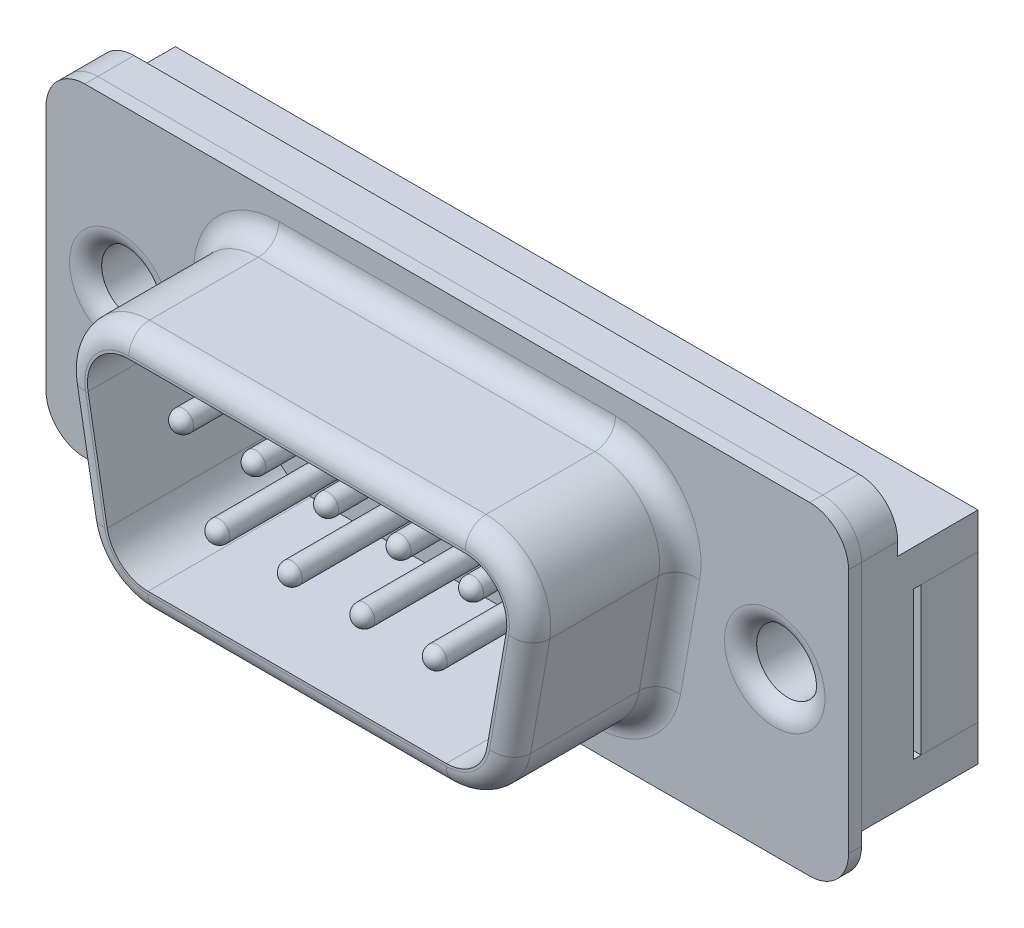
from build123d import *

# Parameters (mm, degrees)
CROQUIS1_W            = 31
CROQUIS1_H            = 12.5
EXTRUIR1_DEPTH        = 0.5
REDONDEO1_R           = 1.5
EXTRUIR2_DEPTH        = 5.8
CORTAR_EXTRUIR1_DEPTH = 9.8
REDONDEO2_R           = 0.8
REDONDEO3_R           = 0.8
CROQUIS4_R            = 1.2
CORTAR_EXTRUIR2_DEPTH = 9.8
REDONDEO4_R           = 0.8
EXTRUIR3_DEPTH        = 4.5
CROQUIS6_W            = 4.094383516
CROQUIS6_H            = 3.116234629
CORTAR_EXTRUIR3_DEPTH = 36.5
CROQUIS7_W            = 5.7
CROQUIS7_H            = 5.7
CORTAR_EXTRUIR4_DEPTH = 2.5
CROQUIS8_R            = 1.2
CORTAR_EXTRUIR5_DEPTH = 2.5
CROQUIS11_W           = 5.7
CROQUIS11_H           = 5.7
CROQUIS11_R           = 1.2
EXTRUIR5_DEPTH        = 2.2
EXTRUIR5_2_DEPTH      = 2.2
CROQUIS12_R           = 0.4
EXTRUIR6_DEPTH        = 5.5
EXTRUIR6_2_DEPTH      = 5.5
EXTRUIR6_3_DEPTH      = 5.5
EXTRUIR6_4_DEPTH      = 5.5
EXTRUIR6_5_DEPTH      = 5.5
EXTRUIR6_6_DEPTH      = 5.5
EXTRUIR6_7_DEPTH      = 5.5
EXTRUIR6_8_DEPTH      = 5.5
EXTRUIR6_9_DEPTH      = 5.5
REDONDEO5_R           = 0.4
REDONDEO6_R           = 0.4
REDONDEO7_R           = 0.4
REDONDEO8_R           = 0.4
REDONDEO9_R           = 0.4
REDONDEO10_R          = 0.4
REDONDEO11_R          = 0.4
REDONDEO12_R          = 0.4
REDONDEO13_R          = 0.4


with BuildPart() as part:
    # Croquis1 → Extruir1 (new body)
    with BuildSketch(Plane.XY):
        Rectangle(CROQUIS1_W, CROQUIS1_H)
    extrude(amount=EXTRUIR1_DEPTH)

    # Redondeo1
    redondeo1_edges = [part.edges().sort_by_distance(p)[0] for p in [
        (-15.5, 6.25, 0.25),
        (15.5, 6.25, 0.25),
        (15.5, -6.25, 0.25),
        (-15.5, -6.25, 0.25),
    ]]
    fillet(redondeo1_edges, radius=REDONDEO1_R)

    # Croquis2 → Extruir2 (add)
    with BuildSketch(Plane.XY.offset(0.5)):
        with BuildLine():
            Line((-6.5, 4.6), (6.5, 4.6))
            ThreePointArc((6.5, 4.6), (8.415111108, 3.706969024), (8.962019383, 1.665879556))
            Line((8.962019383, 1.665879556), (8.221446064, -2.534120444))
            ThreePointArc((8.221446064, -2.534120444), (7.366395705, -4.015111108), (5.759426681, -4.6))
            Line((5.759426681, -4.6), (-5.759426681, -4.6))
            ThreePointArc((-5.759426681, -4.6), (-7.366395705, -4.015111108), (-8.221446064, -2.534120444))
            Line((-8.221446064, -2.534120444), (-8.962019383, 1.665879556))
            ThreePointArc((-8.962019383, 1.665879556), (-8.415111108, 3.706969024), (-6.5, 4.6))
        make_face()
    extrude(amount=EXTRUIR2_DEPTH)

    # Croquis3 → Cortar-Extruir1 (cut)
    with BuildSketch(Plane.XY.offset(6.3)):
        with BuildLine():
            Line((-5.759426681, -3.7), (5.759426681, -3.7))
            ThreePointArc((5.759426681, -3.7), (6.787886857, -3.325671109), (7.335119086, -2.377837084))
            Line((7.335119086, -2.377837084), (8.075692405, 1.822162916))
            ThreePointArc((8.075692405, 1.822162916), (7.725671109, 3.128460175), (6.5, 3.7))
            Line((6.5, 3.7), (-6.5, 3.7))
            ThreePointArc((-6.5, 3.7), (-7.725671109, 3.128460175), (-8.075692405, 1.822162916))
            Line((-8.075692405, 1.822162916), (-7.335119086, -2.377837084))
            ThreePointArc((-7.335119086, -2.377837084), (-6.787886857, -3.325671109), (-5.759426681, -3.7))
        make_face()
    extrude(amount=-CORTAR_EXTRUIR1_DEPTH, mode=Mode.SUBTRACT)

    # Redondeo2
    redondeo2_edges = [part.edges().sort_by_distance(p)[0] for p in [
        (-7.366395705, -4.015111108, 6.3),
        (0, -4.6, 6.3),
        (7.366395705, -4.015111108, 6.3),
        (8.591732723, -0.434120444, 6.3),
        (8.415111108, 3.706969024, 6.3),
        (0, 4.6, 6.3),
        (-8.415111108, 3.706969024, 6.3),
        (-8.591732723, -0.434120444, 6.3),
    ]]
    fillet(redondeo2_edges, radius=REDONDEO2_R)

    # Redondeo3
    redondeo3_edges = [part.edges().sort_by_distance(p)[0] for p in [
        (-7.366395705, -4.015111108, 0.5),
        (0, -4.6, 0.5),
        (7.366395705, -4.015111108, 0.5),
        (8.591732723, -0.434120444, 0.5),
        (8.415111108, 3.706969024, 0.5),
        (0, 4.6, 0.5),
        (-8.415111108, 3.706969024, 0.5),
        (-8.591732723, -0.434120444, 0.5),
    ]]
    fillet(redondeo3_edges, radius=REDONDEO3_R)

    # Croquis4 → Cortar-Extruir2 (cut)
    with BuildSketch(Plane.XY.offset(0.5)):
        with Locations((12.65, 0)):
            Circle(CROQUIS4_R)
        with Locations((-12.65, 0)):
            Circle(CROQUIS4_R)
    extrude(amount=-CORTAR_EXTRUIR2_DEPTH, mode=Mode.SUBTRACT)

    # Redondeo4
    # the kernel refuses this fillet: 0.8 mm, written as the material it takes off along each edge
    with BuildSketch(Plane(origin=(12.65, 0, 0.5), x_dir=(1, 0, 0), z_dir=(0, -1, 0))) as redondeo4_piece_1:
        with BuildLine():
            CenterArc((1.941619849, -0.8), REDONDEO4_R, 90, 67.975687163)
            Line((1.2, -0.5), (1.185167603, -0.494))
            ThreePointArc((1.185167603, -0.494), (1.184, -0.25), (1.184, 0))
            Line((1.184, 0), (1.2, 0.016))
            Line((1.2, 0.016), (1.941619849, 0.016))
            Line((1.941619849, 0.016), (1.941619849, 0))
        make_face()
    revolve(axis=Axis((12.65, 0, 0.5), (0, 0, 1)), mode=Mode.SUBTRACT)
    with BuildSketch(Plane(origin=(-12.65, 0, 0.5), x_dir=(1, 0, 0), z_dir=(0, -1, 0))) as redondeo4_piece_2:
        with BuildLine():
            CenterArc((1.941619849, -0.8), REDONDEO4_R, 90, 67.975687163)
            Line((1.2, -0.5), (1.185167603, -0.494))
            ThreePointArc((1.185167603, -0.494), (1.184, -0.25), (1.184, 0))
            Line((1.184, 0), (1.2, 0.016))
            Line((1.2, 0.016), (1.941619849, 0.016))
            Line((1.941619849, 0.016), (1.941619849, 0))
        make_face()
    revolve(axis=Axis((-12.65, 0, 0.5), (0, 0, 1)), mode=Mode.SUBTRACT)


with BuildPart() as body_2:
    # Croquis5 → Extruir3 (new body)
    with BuildSketch(Plane(origin=(0, 0, 0), x_dir=(-1, 0, 0), z_dir=(0, 0, -1))):
        with BuildLine():
            Line((-14, 6.25), (14, 6.25))
            ThreePointArc((14, 6.25), (15.060660172, 5.810660172), (15.5, 4.75))
            Line((15.5, 4.75), (15.5, -4.25))
            Line((15.5, -4.25), (-15.5, -4.25))
            Line((-15.5, -4.25), (-15.5, 4.75))
            ThreePointArc((-15.5, 4.75), (-15.060660172, 5.810660172), (-14, 6.25))
        make_face()
    extrude(amount=EXTRUIR3_DEPTH)

    # Croquis6 → Cortar-Extruir3 (cut)
    with BuildSketch(Plane(origin=(15.5, 0, 0), x_dir=(0, 0, -1), z_dir=(1, 0, 0))):
        with Locations((3.447191758, 5.808117315)):
            Rectangle(CROQUIS6_W, CROQUIS6_H)
    extrude(amount=-CORTAR_EXTRUIR3_DEPTH, mode=Mode.SUBTRACT)

    # Croquis7 → Cortar-Extruir4 (cut)
    with BuildSketch(Plane(origin=(0, 0, -4.5), x_dir=(-1, 0, 0), z_dir=(0, 0, -1))):
        with Locations((-12.65, 0)):
            Rectangle(CROQUIS7_W, CROQUIS7_H)
        with Locations((12.65, 0)):
            Rectangle(CROQUIS7_W, CROQUIS7_H)
    extrude(amount=-CORTAR_EXTRUIR4_DEPTH, mode=Mode.SUBTRACT)

    # Croquis8 → Cortar-Extruir5 (cut)
    with BuildSketch(Plane(origin=(0, 0, -2), x_dir=(-1, 0, 0), z_dir=(0, 0, -1))):
        with Locations((-12.65, 0)):
            Circle(CROQUIS8_R)
        with Locations((12.65, 0)):
            Circle(CROQUIS8_R)
    extrude(amount=-CORTAR_EXTRUIR5_DEPTH, mode=Mode.SUBTRACT)


with BuildPart() as body_3:
    # Croquis11 → Extruir5 (new body)
    with BuildSketch(Plane(origin=(0, 0, -4.5), x_dir=(-1, 0, 0), z_dir=(0, 0, -1))):
        with Locations((-12.65, 0)):
            Rectangle(CROQUIS11_W, CROQUIS11_H)
        with Locations((-12.65, 0)):
            Circle(CROQUIS11_R, mode=Mode.SUBTRACT)
    extrude(amount=-EXTRUIR5_DEPTH)


with BuildPart() as body_4:
    # Croquis11 → Extruir5 2 (new body)
    with BuildSketch(Plane(origin=(0, 0, -4.5), x_dir=(-1, 0, 0), z_dir=(0, 0, -1))):
        with Locations((12.65, 0)):
            Rectangle(CROQUIS11_W, CROQUIS11_H)
        with Locations((12.65, 0)):
            Circle(CROQUIS11_R, mode=Mode.SUBTRACT)
    extrude(amount=-EXTRUIR5_2_DEPTH)


with BuildPart() as body_5:
    # Croquis12 → Extruir6 (new body)
    with BuildSketch(Plane.XY):
        with Locations((0, 1.5)):
            Circle(CROQUIS12_R)
    extrude(amount=EXTRUIR6_DEPTH)

    # Redondeo7
    redondeo7_edges = [body_5.edges().sort_by_distance(p)[0] for p in [
        (-0.4, 1.5, 5.5),
    ]]
    fillet(redondeo7_edges, radius=REDONDEO7_R)


with BuildPart() as body_6:
    # Croquis12 → Extruir6 2 (new body)
    with BuildSketch(Plane.XY):
        with Locations((2.8, 1.5)):
            Circle(CROQUIS12_R)
    extrude(amount=EXTRUIR6_2_DEPTH)

    # Redondeo8
    redondeo8_edges = [body_6.edges().sort_by_distance(p)[0] for p in [
        (2.4, 1.5, 5.5),
    ]]
    fillet(redondeo8_edges, radius=REDONDEO8_R)


with BuildPart() as body_7:
    # Croquis12 → Extruir6 3 (new body)
    with BuildSketch(Plane.XY):
        with Locations((5.6, 1.5)):
            Circle(CROQUIS12_R)
    extrude(amount=EXTRUIR6_3_DEPTH)

    # Redondeo9
    redondeo9_edges = [body_7.edges().sort_by_distance(p)[0] for p in [
        (5.2, 1.5, 5.5),
    ]]
    fillet(redondeo9_edges, radius=REDONDEO9_R)


with BuildPart() as body_8:
    # Croquis12 → Extruir6 4 (new body)
    with BuildSketch(Plane.XY):
        with Locations(Location((-5.6, 1.5, 0), (0, 0, 180))):
            Circle(CROQUIS12_R)
    extrude(amount=EXTRUIR6_4_DEPTH)

    # Redondeo5
    redondeo5_edges = [body_8.edges().sort_by_distance(p)[0] for p in [
        (-5.2, 1.5, 5.5),
    ]]
    fillet(redondeo5_edges, radius=REDONDEO5_R)


with BuildPart() as body_9:
    # Croquis12 → Extruir6 5 (new body)
    with BuildSketch(Plane.XY):
        with Locations(Location((-2.8, 1.5, 0), (0, 0, 180))):
            Circle(CROQUIS12_R)
    extrude(amount=EXTRUIR6_5_DEPTH)

    # Redondeo6
    redondeo6_edges = [body_9.edges().sort_by_distance(p)[0] for p in [
        (-2.4, 1.5, 5.5),
    ]]
    fillet(redondeo6_edges, radius=REDONDEO6_R)


with BuildPart() as body_10:
    # Croquis12 → Extruir6 6 (new body)
    with BuildSketch(Plane.XY):
        with Locations(Location((-4.2, -1.5, 0), (0, 0, 180))):
            Circle(CROQUIS12_R)
    extrude(amount=EXTRUIR6_6_DEPTH)

    # Redondeo10
    redondeo10_edges = [body_10.edges().sort_by_distance(p)[0] for p in [
        (-3.8, -1.5, 5.5),
    ]]
    fillet(redondeo10_edges, radius=REDONDEO10_R)


with BuildPart() as body_11:
    # Croquis12 → Extruir6 7 (new body)
    with BuildSketch(Plane.XY):
        with Locations(Location((-1.4, -1.5, 0), (0, 0, 180))):
            Circle(CROQUIS12_R)
    extrude(amount=EXTRUIR6_7_DEPTH)

    # Redondeo11
    redondeo11_edges = [body_11.edges().sort_by_distance(p)[0] for p in [
        (-1, -1.5, 5.5),
    ]]
    fillet(redondeo11_edges, radius=REDONDEO11_R)


with BuildPart() as body_12:
    # Croquis12 → Extruir6 8 (new body)
    with BuildSketch(Plane.XY):
        with Locations((1.4, -1.5)):
            Circle(CROQUIS12_R)
    extrude(amount=EXTRUIR6_8_DEPTH)

    # Redondeo12
    redondeo12_edges = [body_12.edges().sort_by_distance(p)[0] for p in [
        (1, -1.5, 5.5),
    ]]
    fillet(redondeo12_edges, radius=REDONDEO12_R)


with BuildPart() as body_13:
    # Croquis12 → Extruir6 9 (new body)
    with BuildSketch(Plane.XY):
        with Locations((4.2, -1.5)):
            Circle(CROQUIS12_R)
    extrude(amount=EXTRUIR6_9_DEPTH)

    # Redondeo13
    redondeo13_edges = [body_13.edges().sort_by_distance(p)[0] for p in [
        (3.8, -1.5, 5.5),
    ]]
    fillet(redondeo13_edges, radius=REDONDEO13_R)


solid = Compound([part.part, body_2.part, body_3.part, body_4.part, body_5.part, body_6.part, body_7.part, body_8.part, body_9.part, body_10.part, body_11.part, body_12.part, body_13.part])
